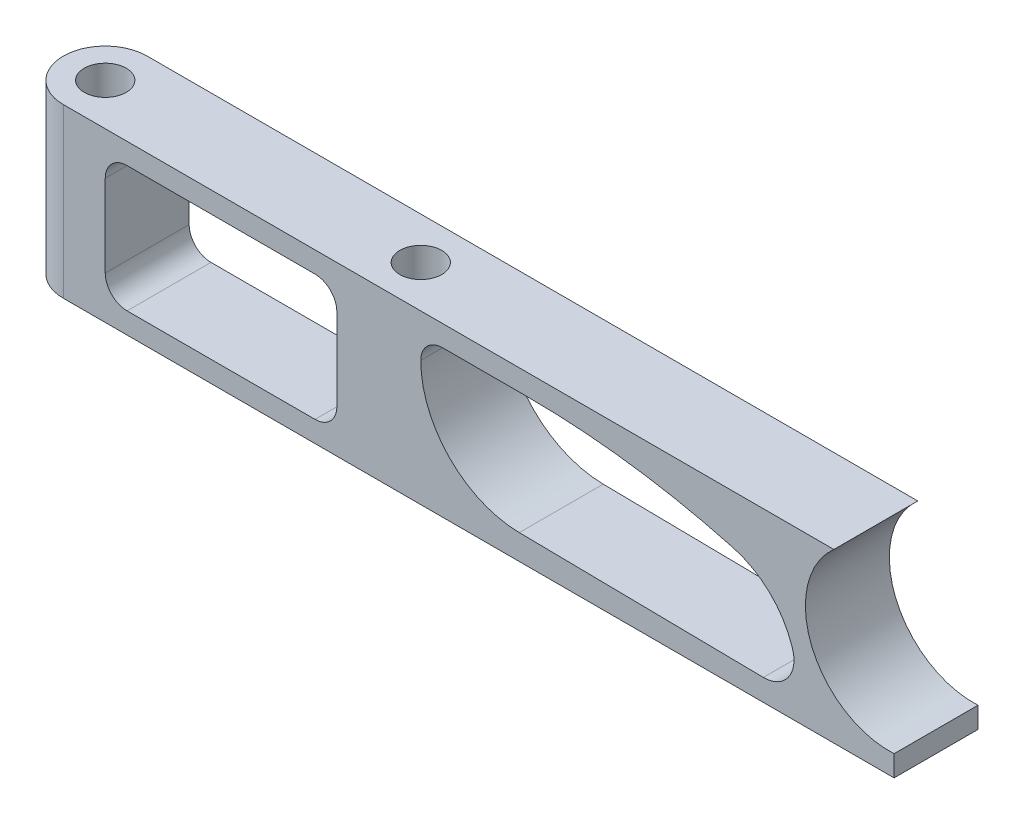
from build123d import *

# Parameters (mm, degrees)
SKETCH1_W           = 133.35
SKETCH1_H           = 38.1
BOSS_EXTRUDE1_DEPTH = 12.7
SKETCH2_R           = 3.175
CUT_EXTRUDE1_DEPTH  = 111.707422131
CAVITY1_DEPTH       = 12.7
CUT_EXTRUDE2_DEPTH  = 108.192417986
CUT_EXTRUDE4_DEPTH  = 108.192417986
CUT_EXTRUDE6_DEPTH  = 108.000606538
CUT_EXTRUDE7_DEPTH  = 105.814568341


# Read off the part's stored shape, not the designer's step: Cavity1
with BuildPart() as part:
    # Sketch1 → Boss-Extrude1 (new body)
    with BuildSketch(Plane.XY):
        with Locations((36.491047297, -7.135705236)):
            Rectangle(SKETCH1_W, SKETCH1_H)
    extrude(amount=BOSS_EXTRUDE1_DEPTH)

    # Sketch2 → Cut-Extrude1 (cut, through all)
    with BuildSketch(Plane(origin=(0, 11.914294764, 0), x_dir=(1, 0, 0), z_dir=(0, 1, 0))):
        with Locations(Location((-22.563952703, -6.35, 0), (0, 0, 270))):
            Circle(SKETCH2_R)
        with Locations(Location((25.188047297, -6.35, 0), (0, 0, 270))):
            Circle(SKETCH2_R)
    extrude(amount=-CUT_EXTRUDE1_DEPTH, mode=Mode.SUBTRACT)

    # Cavity1 outline → Cavity1 (cut)
    with BuildSketch(Plane.XY):
        with BuildLine():
            Line((96.096303093, 11.914294764), (94.056580093, 11.914294764))
            ThreePointArc((94.056580093, 11.914294764), (90.695637122, -2.438784083), (103.166047297, -10.299806924))
            Line((103.166047297, -10.299806924), (103.166047297, -9.052983376))
            ThreePointArc((103.166047297, -9.052983376), (91.591067883, -1.280306677), (96.096303093, 11.914294764))
        make_face()
    extrude(amount=CAVITY1_DEPTH, mode=Mode.SUBTRACT)

    # Sketch4 → Cut-Extrude2 (cut, through all)
    with BuildSketch(Plane(origin=(0, 0, 0), x_dir=(-1, 0, 0), z_dir=(0, 0, -1))):
        Polygon((-103.836015624, 12.337344095), (-103.707966328, -9.632256534), (-101.439664514, -9.485914481), (-98.220139359, -8.863960758), (-94.579880804, -6.924928563), (-91.031086031, -2.168811857), (-90.317668525, 2.879988954), (-91.085877767, 6.8566015), (-93.116460279, 9.831236447), (-96.207936138, 13.398323976), align=None)
    extrude(amount=-CUT_EXTRUDE2_DEPTH, mode=Mode.SUBTRACT)

    # Sketch9 → Cut-Extrude4 (cut, through all)
    with BuildSketch(Plane.XY.offset(12.7)):
        Polygon((-30.183952703, -13.474806924), (119.048045807, -13.474806924), (119.048045807, -32.591302601), (-30.183952703, -32.591302601), (-44.866857433, -32.591302601), (-44.866857433, 12.516766533), (-30.183952703, 12.516766533), align=None)
    extrude(amount=-CUT_EXTRUDE4_DEPTH, mode=Mode.SUBTRACT)

    # Sketch11 → Cut-Extrude6 (cut, through all)
    with BuildSketch(Plane(origin=(0, 11.914294764, 0), x_dir=(1, 0, 0), z_dir=(0, 1, 0))):
        with BuildLine():
            Line((-22.563952703, 0), (-30.183952703, 0))
            Line((-30.183952703, 0), (-30.183952703, -12.7))
            Line((-30.183952703, -12.7), (-22.563952703, -12.7))
            ThreePointArc((-22.563952703, -12.7), (-28.913952703, -6.35), (-22.563952703, 0))
        make_face()
    extrude(amount=-CUT_EXTRUDE6_DEPTH, mode=Mode.SUBTRACT)

    # Sketch12 → Cut-Extrude7 (cut, through all)
    with BuildSketch(Plane.XY):
        with BuildLine():
            Line((34.840047297, 8.739294764), (47.329311848, 8.739294764))
            ThreePointArc((47.329311848, 8.739294764), (63.205042995, 7.678873093), (78.798708551, 4.516448692))
            ThreePointArc((78.798708551, 4.516448692), (84.297585987, 1.423684462), (87.687974389, -3.896852177))
            Line((87.687974389, -3.896852177), (87.782466122, -4.180292862))
            ThreePointArc((87.782466122, -4.180292862), (87.135514906, -8.32519055), (83.381577499, -10.197802807))
            Line((83.381577499, -10.197802807), (46.450888554, -9.684330956))
            ThreePointArc((46.450888554, -9.684330956), (35.893420387, -5.181749435), (31.538047297, 5.437294764))
            ThreePointArc((31.538047297, 5.437294764), (32.505180706, 7.772161355), (34.840047297, 8.739294764))
        make_face()
        with BuildLine():
            Line((18.838047297, 5.437294764), (18.838047297, -6.997806924))
            ThreePointArc((18.838047297, -6.997806924), (17.870913889, -9.332673515), (15.536047297, -10.299806924))
            Line((15.536047297, -10.299806924), (-12.911952703, -10.299806924))
            ThreePointArc((-12.911952703, -10.299806924), (-15.246819294, -9.332673515), (-16.213952703, -6.997806924))
            Line((-16.213952703, -6.997806924), (-16.213952703, 5.437294764))
            ThreePointArc((-16.213952703, 5.437294764), (-15.246819294, 7.772161355), (-12.911952703, 8.739294764))
            Line((-12.911952703, 8.739294764), (15.536047297, 8.739294764))
            ThreePointArc((15.536047297, 8.739294764), (17.870913889, 7.772161355), (18.838047297, 5.437294764))
        make_face()
    extrude(amount=CUT_EXTRUDE7_DEPTH, mode=Mode.SUBTRACT)


solid = part.part
